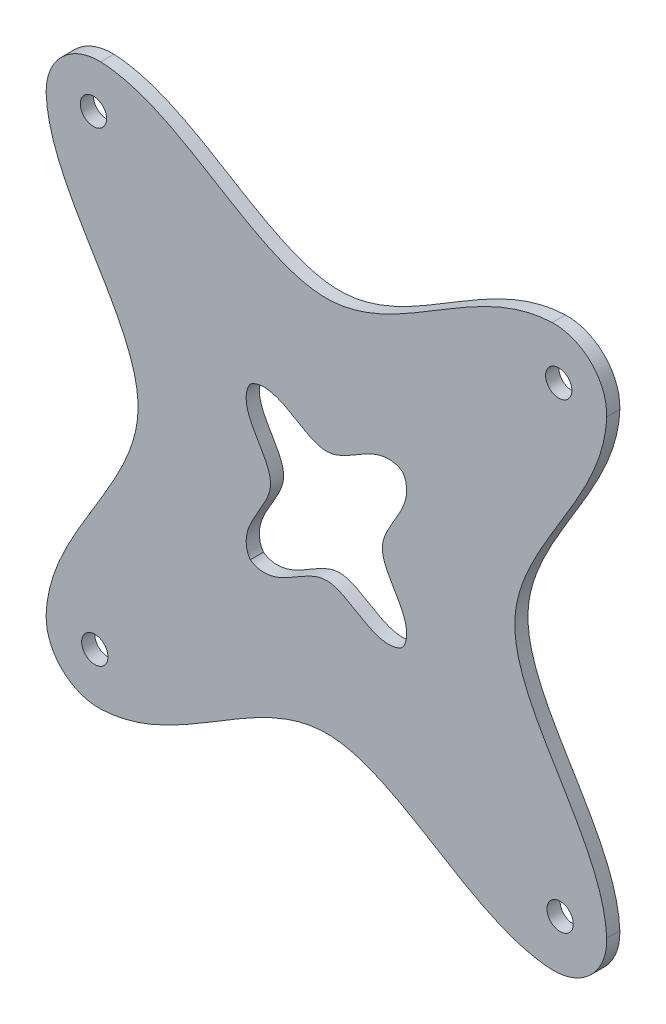
from build123d import *

# Parameters (mm, degrees)
BOSS_EXTRUDE1_DEPTH = 1.27
FILLET1_START       = -1
FILLET1_DEPTH       = 3
FILLET2_START       = -1
FILLET2_DEPTH       = 3
FILLET3_R           = 5.08
FILLET4_R           = 5.08
SKETCH3_R           = 1.27
CUT_EXTRUDE1_DEPTH  = 39.269062151


with BuildPart() as part:
    # Sketch1 → Boss-Extrude1 (new body)
    with BuildSketch(Plane.XY):
        with BuildLine():
            add(Edge.make_bspline(
                [(-26.078451224, -26.078451224), (-25.595030672, -26.46689269), (-16.201372292, -29.50543677), (0, -7.636650328), (16.201372291, -29.50543677), (25.595030672, -26.46689269), (26.078451224, -26.078451224)],
                knots=[0.032766754, 0.032766754, 0.032766754, 0.032766754, 0.065533508, 0.5, 0.934466492, 0.967233246, 0.967233246, 0.967233246, 0.967233246], degree=3))
            add(Edge.make_bspline(
                [(26.078451224, -26.078451224), (26.46689269, -25.595030672), (29.505436772, -16.201372289), (7.636650328, -2e-09), (29.505436768, 16.201372294), (26.46689269, 25.595030672), (26.078451224, 26.078451224)],
                knots=[0.032766754, 0.032766754, 0.032766754, 0.032766754, 0.065533508, 0.5, 0.934466492, 0.967233246, 0.967233246, 0.967233246, 0.967233246], degree=3))
            add(Edge.make_bspline(
                [(-26.078451224, 26.078451224), (-25.595030672, 26.46689269), (-16.201372292, 29.50543677), (0, 7.636650328), (16.201372291, 29.50543677), (25.595030672, 26.46689269), (26.078451224, 26.078451224)],
                knots=[0.032766754, 0.032766754, 0.032766754, 0.032766754, 0.065533508, 0.5, 0.934466492, 0.967233246, 0.967233246, 0.967233246, 0.967233246], degree=3))
            add(Edge.make_bspline(
                [(-26.078451224, -26.078451224), (-26.46689269, -25.595030672), (-29.50543677, -16.201372292), (-7.636650328, 0), (-29.50543677, 16.201372291), (-26.46689269, 25.595030672), (-26.078451224, 26.078451224)],
                knots=[0.032766754, 0.032766754, 0.032766754, 0.032766754, 0.065533508, 0.5, 0.934466492, 0.967233246, 0.967233246, 0.967233246, 0.967233246], degree=3))
        make_face()
    extrude(amount=BOSS_EXTRUDE1_DEPTH)

    # Fillet1: read off the stored shape, not the designer's step
    # Fillet1 outline → Fillet1 (cut)
    with BuildSketch(Plane.XY.offset(FILLET1_START)):
        with BuildLine():
            add(Edge.make_bspline(
                [(26.078451224, 26.078451224), (25.595030672, 26.46689269), (24.088787806, 26.954113447), (22.608220096, 27.071858625), (21.782533291, 27.042115453)],
                knots=[0.032766754, 0.032766754, 0.032766754, 0.032766754, 0.065533508, 0.1076861, 0.1076861, 0.1076861, 0.1076861], degree=3))
            ThreePointArc((21.782533291, 27.042115453), (25.557510624, 25.557510623), (27.042115452, 21.78253329))
            add(Edge.make_bspline(
                [(27.042115452, 21.78253329), (27.071858625, 22.608220095), (26.954113447, 24.088787806), (26.46689269, 25.595030672), (26.078451224, 26.078451224)],
                knots=[0.8923139, 0.8923139, 0.8923139, 0.8923139, 0.934466492, 0.967233246, 0.967233246, 0.967233246, 0.967233246], degree=3))
        make_face()
    extrude(amount=FILLET1_DEPTH, mode=Mode.SUBTRACT)

    # Fillet2: read off the stored shape, not the designer's step
    # Fillet2 outline → Fillet2 (cut)
    with BuildSketch(Plane.XY.offset(FILLET2_START)):
        with BuildLine():
            add(Edge.make_bspline(
                [(-26.078451224, -26.078451224), (-25.595030672, -26.46689269), (-24.088787806, -26.954113447), (-22.608220096, -27.071858625), (-21.782533291, -27.042115453)],
                knots=[0.032766754, 0.032766754, 0.032766754, 0.032766754, 0.065533508, 0.1076861, 0.1076861, 0.1076861, 0.1076861], degree=3))
            ThreePointArc((-21.782533291, -27.042115453), (-25.557510624, -25.557510624), (-27.042115453, -21.782533291))
            add(Edge.make_bspline(
                [(-27.042115453, -21.782533291), (-27.071858625, -22.608220096), (-26.954113447, -24.088787806), (-26.46689269, -25.595030672), (-26.078451224, -26.078451224)],
                knots=[0.8923139, 0.8923139, 0.8923139, 0.8923139, 0.934466492, 0.967233246, 0.967233246, 0.967233246, 0.967233246], degree=3))
        make_face()
    extrude(amount=FILLET2_DEPTH, mode=Mode.SUBTRACT)

    # Fillet3
    fillet3_edges = [part.edges().sort_by_distance(p)[0] for p in [
        (-26.078451224, 26.078451224, 0.635),
    ]]
    fillet(fillet3_edges, radius=FILLET3_R)

    # Fillet4
    fillet4_edges = [part.edges().sort_by_distance(p)[0] for p in [
        (26.078451224, -26.078451224, 0.635),
    ]]
    fillet(fillet4_edges, radius=FILLET4_R)

    # Sketch3 → Cut-Extrude1 (cut, through all)
    with BuildSketch(Plane.XY.offset(1.27)):
        with Locations((-22.483919179, 22.563317918)):
            Circle(SKETCH3_R)
        with Locations((-22.351271412, -22.337766752)):
            Circle(SKETCH3_R)
        with Locations((22.549813258, -22.205118985)):
            Circle(SKETCH3_R)
        with Locations((22.418317518, 22.306006297)):
            Circle(SKETCH3_R)
        with BuildLine():
            add(Edge.make_bspline(
                [(-7.336925612, -7.336925612), (-7.094564954, -7.539990493), (-4.441685448, -8.467510629), (0, -2.70941912), (4.441685448, -8.467510629), (7.094564954, -7.539990493), (7.336925612, -7.336925612)],
                knots=[0.055321023, 0.055321023, 0.055321023, 0.055321023, 0.110642047, 0.5, 0.889357953, 0.944678976, 0.944678976, 0.944678976, 0.944678976], degree=3))
            add(Edge.make_bspline(
                [(7.336925612, 7.336925612), (7.539990493, 7.094564954), (8.467510629, 4.441685448), (2.70941912, 0), (8.467510629, -4.441685448), (7.539990493, -7.094564954), (7.336925612, -7.336925612)],
                knots=[0.055321023, 0.055321023, 0.055321023, 0.055321023, 0.110642047, 0.5, 0.889357953, 0.944678977, 0.944678977, 0.944678977, 0.944678977], degree=3))
            add(Edge.make_bspline(
                [(-7.336925612, 7.336925612), (-7.094564954, 7.539990493), (-4.441685448, 8.467510629), (0, 2.70941912), (4.441685448, 8.467510629), (7.094564954, 7.539990493), (7.336925612, 7.336925612)],
                knots=[0.055321023, 0.055321023, 0.055321023, 0.055321023, 0.110642047, 0.5, 0.889357953, 0.944678977, 0.944678977, 0.944678977, 0.944678977], degree=3))
            add(Edge.make_bspline(
                [(-7.336925612, 7.336925612), (-7.539990493, 7.094564954), (-8.467510629, 4.441685448), (-2.70941912, 0), (-8.467510629, -4.441685448), (-7.539990493, -7.094564954), (-7.336925612, -7.336925612)],
                knots=[0.055321023, 0.055321023, 0.055321023, 0.055321023, 0.110642047, 0.5, 0.889357953, 0.944678977, 0.944678977, 0.944678977, 0.944678977], degree=3))
        make_face()
    extrude(amount=-CUT_EXTRUDE1_DEPTH, mode=Mode.SUBTRACT)


solid = part.part
